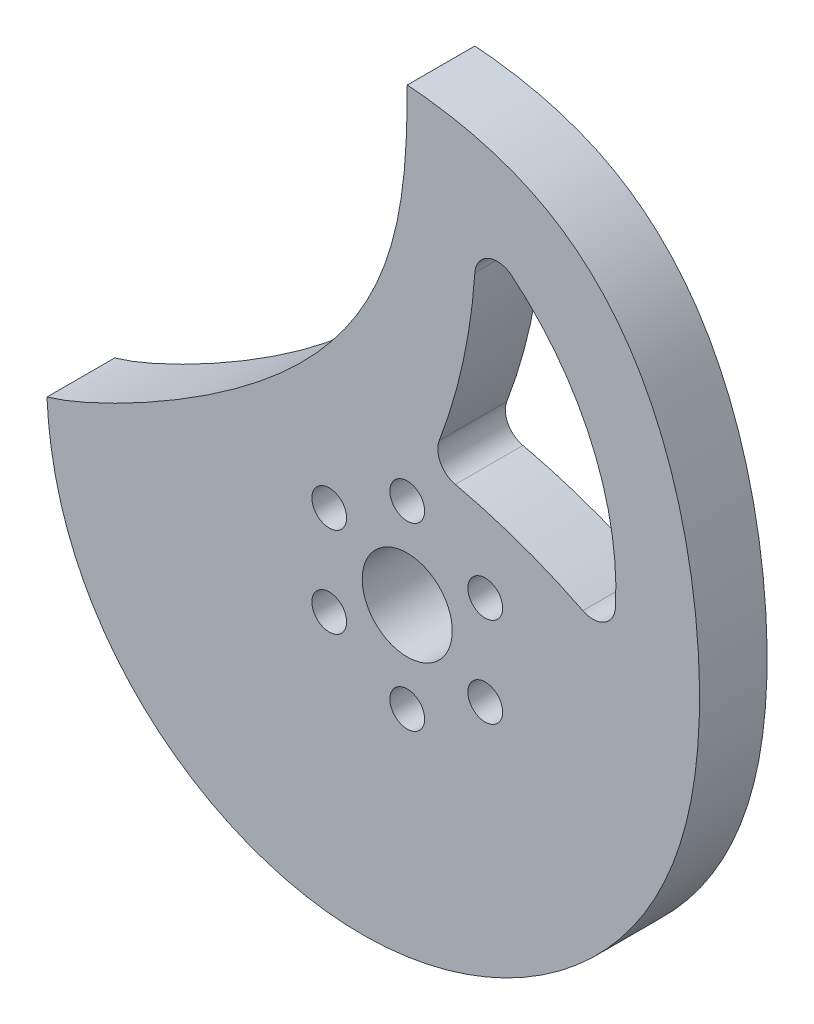
from build123d import *

# Parameters (mm, degrees)
SKETCH1_R           = 12.7
BOSS_EXTRUDE1_DEPTH = 19.05
SKETCH2_R           = 4.9022
CUT_EXTRUDE1_DEPTH  = 19.05


with BuildPart() as part:
    # Sketch1 → Boss-Extrude1 (new body)
    with BuildSketch(Plane(origin=(0, 0, 0), x_dir=(-1, 0, 0), z_dir=(0, 0, -1))):
        with BuildLine():
            add(Edge.make_bspline(
                [(101.6, 0), (101.32208867, -6.136488525), (99.965807152, -17.952949824), (95.529874176, -34.308259364), (85.074625768, -53.243582505), (65.991426873, -71.430324737), (42.986480868, -83.333396889), (18.270870089, -88.387072092), (-6.080373441, -86.433983418), (-28.770430703, -78.329979357), (-48.625489626, -65.160533517), (-64.506059429, -47.92429245), (-75.654946743, -27.560711681), (-81.728973879, -4.938917232), (-83.304972238, 19.372312845), (-81.401658445, 44.656591936), (-75.889556202, 69.105898036), (-66.571386811, 90.740483473), (-53.353364798, 107.75154214), (-36.946563703, 119.046068508), (-18.981285454, 124.816190327), (-7.107980708, 126.450303588), (-1.840493437, 126.899964589), (-0.28711634, 127), (0, 127)],
                knots=[-1, -1, -1, -1, -1, -1, -0.95, -0.9, -0.85, -0.8, -0.75, -0.7, -0.65, -0.6, -0.55, -0.5, -0.45, -0.4, -0.35, -0.3, -0.25, -0.2, -0.15, -0.1, -0.05, 0, 0, 0, 0, 0, 0], degree=5))
            add(Edge.make_bspline(
                [(0, 127), (0, 125.478820477), (0.017668576, 122.257003221), (0.0972057, 116.885922928), (0.398911953, 108.719650428), (1.597057917, 97.258110232), (4.205074859, 85.094095292), (8.737985203, 72.807961005), (15.443291014, 60.901238952), (24.156375536, 49.713603466), (34.445644593, 39.469197718), (45.707336285, 30.301519137), (57.269406734, 22.280731267), (68.481604879, 15.434066219), (78.816351629, 9.763823916), (87.948221573, 5.261047508), (94.144249466, 2.583421629), (98.130881968, 1.091339634), (100.492913455, 0.32561369), (101.6, 0)],
                knots=[0, 0, 0, 0, 0, 0, 0.066666667, 0.133333333, 0.2, 0.266666667, 0.333333333, 0.4, 0.466666667, 0.533333333, 0.6, 0.666666667, 0.733333333, 0.8, 0.866666667, 0.933333333, 1, 1, 1, 1, 1, 1], degree=5))
        make_face()
        Circle(SKETCH1_R, mode=Mode.SUBTRACT)
        with BuildLine():
            ThreePointArc((-58.707286474, 28.704291043), (-52.047081401, 65.466533842), (-29.419483182, 95.195520137))
            ThreePointArc((-29.419483182, 95.195520137), (-22.875714103, 96.100904583), (-19.06862847, 90.702133081))
            ThreePointArc((-19.06862847, 90.702133081), (-15.748701126, 67.316990393), (-9.022187948, 44.675417202))
            ThreePointArc((-9.022187948, 44.675417202), (-9.365569099, 39.416971387), (-13.561125707, 36.228481503))
            ThreePointArc((-13.561125707, 36.228481503), (-31.932324156, 30.89594831), (-49.525218191, 23.384162759))
            ThreePointArc((-49.525218191, 23.384162759), (-55.550862543, 23.568217262), (-58.707286474, 28.704291043))
        make_face(mode=Mode.SUBTRACT)
    extrude(amount=-BOSS_EXTRUDE1_DEPTH)

    # Sketch2 → Cut-Extrude1 (cut)
    with BuildSketch(Plane.XY.offset(19.05)):
        with Locations((0, 25.4)):
            Circle(SKETCH2_R)
        with Locations((21.997045256, 12.7)):
            Circle(SKETCH2_R)
        with Locations((21.997045256, -12.7)):
            Circle(SKETCH2_R)
        with Locations((0, -25.4)):
            Circle(SKETCH2_R)
        with Locations((-21.997045256, -12.7)):
            Circle(SKETCH2_R)
        with Locations((-21.997045256, 12.7)):
            Circle(SKETCH2_R)
    extrude(amount=-CUT_EXTRUDE1_DEPTH, mode=Mode.SUBTRACT)


solid = part.part
